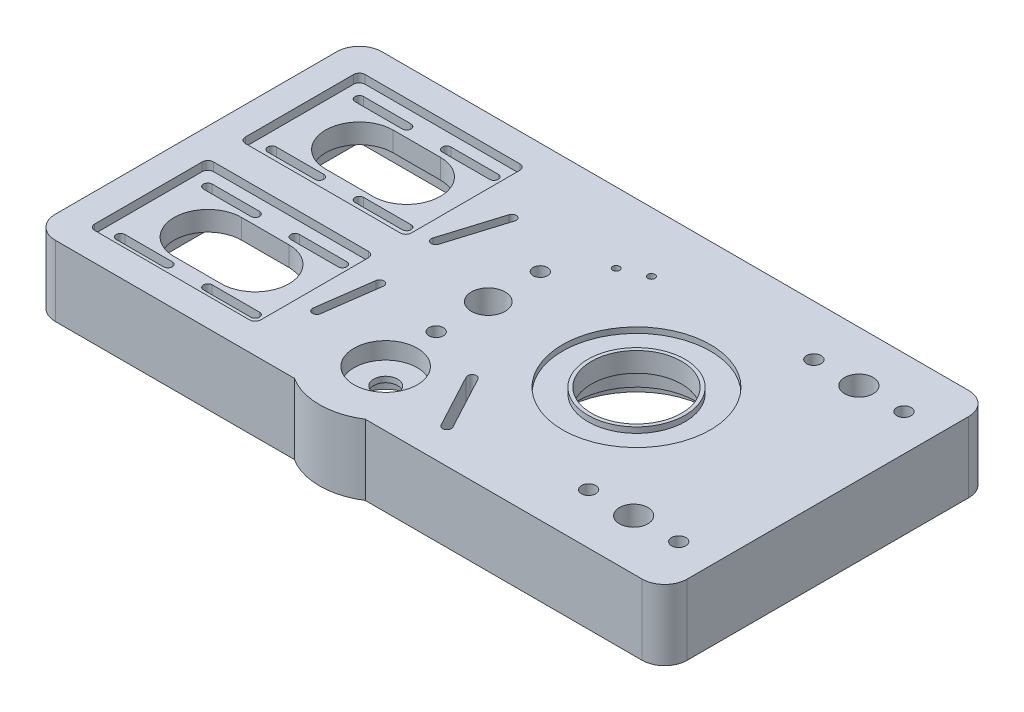
from build123d import *

# Parameters (mm, degrees)
BOSS_EXTRUDE1_DEPTH      = 10
SKETCH6_R                = 30
BOSS_EXTRUDE3_DEPTH      = 10
SKETCH40_R               = 26.25
CUT_EXTRUDE1_DEPTH       = 5
SKETCH42_R               = 21.25
CUT_EXTRUDE2_DEPTH       = 8
SKETCH43_R               = 16
CUT_EXTRUDE3_DEPTH       = 132.224624055
CUT_EXTRUDE4_START       = -2
SKETCH44_R               = 26.25
SKETCH44_R_2             = 17.25
CUT_EXTRUDE4_DEPTH       = 2
CUT_EXTRUDE5_DEPTH       = 3
CUT_EXTRUDE6_DEPTH       = 132.681061503
SKETCH48_R               = 3.5
CUT_EXTRUDE7_DEPTH       = 132.681061503
SKETCH49_R               = 11.25
CUT_EXTRUDE8_DEPTH       = 6
SKETCH50_R               = 4.25
CUT_EXTRUDE9_DEPTH       = 132.327460793
CUT_EXTRUDE10_START      = -2
SKETCH51_R               = 11.25
CUT_EXTRUDE10_DEPTH      = 2
SKETCH56_R               = 5.05
SKETCH56_R_2             = 2.55
CUT_EXTRUDE13_DEPTH      = 133.101862055
SKETCH54_R               = 6
SKETCH54_R_2             = 2.55
CUT_EXTRUDE12_DEPTH      = 10
SKETCH55_R               = 5.05
SKETCH55_R_2             = 2.55
CUT_EXTRUDE14_DEPTH      = 133.101862055
CUT_EXTRUDE17_DEPTH      = 3
EXTRUDE_THIN4_DEPTH      = 15
EXTRUDE_THIN4_DEPTH_BACK = 10
FILLET2_R                = 20
RIB4_REACH               = 139.012
SKETCH70_WALL_W          = 309.542427542
SKETCH70_WALL_H          = 5
RIB5_REACH               = 170.812
SKETCH71_WALL_W          = 363.94870324
SKETCH71_WALL_H          = 5
RIB6_REACH               = 170.812
SKETCH72_WALL_W          = 364.28015487
SKETCH72_WALL_H          = 5
CUT_EXTRUDE18_REACH      = 140.464
SKETCH73_R               = 1.25
CUT_EXTRUDE19_REACH      = 139.012
CUT_EXTRUDE20_REACH      = 139.012
CUT_EXTRUDE21_REACH      = 139.012
BOSS_EXTRUDE4_DEPTH      = 10
CUT_EXTRUDE22_REACH      = 139.012
SKETCH84_R               = 5.05
SKETCH84_R_2             = 2.55
CUT_EXTRUDE23_REACH      = 235.23
SKETCH86_R               = 2.05
SKETCH87_R               = 14
SKETCH87_R_2             = 11.25
BOSS_EXTRUDE5_DEPTH      = 5
BOSS_EXTRUDE6_DEPTH      = 5
CUT_EXTRUDE24_REACH      = 139.649
SKETCH89_R               = 5.05
SKETCH89_R_2             = 2.55


with BuildPart() as part:
    # Sketch1 → Boss-Extrude1 (new body)
    with BuildSketch(Plane(origin=(0, 0, 0), x_dir=(1, 0, 0), z_dir=(0, 1, 0))):
        with BuildLine():
            Line((-113.431000834, 55), (95, 55))
            ThreePointArc((95, 55), (98.535533906, 53.535533906), (100, 50))
            Line((100, 50), (100, -50))
            ThreePointArc((100, -50), (98.535533906, -53.535533906), (95, -55))
            Line((95, -55), (-113.431000834, -55))
            ThreePointArc((-113.431000834, -55), (-116.966534739, -53.535533906), (-118.431000834, -50))
            Line((-118.431000834, -50), (-118.431000834, 50))
            ThreePointArc((-118.431000834, 50), (-116.966534739, 53.535533906), (-113.431000834, 55))
        make_face()
    extrude(amount=BOSS_EXTRUDE1_DEPTH)

    # Sketch6 → Boss-Extrude3 (add)
    with BuildSketch(Plane.XZ):
        with Locations((35, 0)):
            Circle(SKETCH6_R)
    extrude(amount=BOSS_EXTRUDE3_DEPTH)

    # Sketch40 → Cut-Extrude1 (cut)
    with BuildSketch(Plane.XZ.offset(10)):
        with Locations((35, 0)):
            Circle(SKETCH40_R)
    extrude(amount=-CUT_EXTRUDE1_DEPTH, mode=Mode.SUBTRACT)

    # Sketch42 → Cut-Extrude2 (cut)
    with BuildSketch(Plane.XZ.offset(5)):
        with Locations((35, 0)):
            Circle(SKETCH42_R)
    extrude(amount=-CUT_EXTRUDE2_DEPTH, mode=Mode.SUBTRACT)

    # Sketch43 → Cut-Extrude3 (cut, through all)
    with BuildSketch(Plane.XZ.offset(-3)):
        with Locations((35, 0)):
            Circle(SKETCH43_R)
    extrude(amount=-CUT_EXTRUDE3_DEPTH, mode=Mode.SUBTRACT)

    # Sketch44 → Cut-Extrude4 (cut)
    with BuildSketch(Plane(origin=(0, 10, 0), x_dir=(1, 0, 0), z_dir=(0, 1, 0)).offset(CUT_EXTRUDE4_START)):
        with Locations((35, 0)):
            Circle(SKETCH44_R)
        with Locations((35, 0)):
            Circle(SKETCH44_R_2, mode=Mode.SUBTRACT)
    extrude(amount=CUT_EXTRUDE4_DEPTH, mode=Mode.SUBTRACT)

    # Sketch45 → Cut-Extrude5 (cut)
    with BuildSketch(Plane(origin=(0, 10, 0), x_dir=(1, 0, 0), z_dir=(0, 1, 0))):
        with BuildLine():
            Line((-109.431000834, 48), (-54.431000834, 48))
            ThreePointArc((-54.431000834, 48), (-53.016787271, 47.414213562), (-52.431000834, 46))
            Line((-52.431000834, 46), (-52.431000834, 7.5))
            ThreePointArc((-52.431000834, 7.5), (-53.016787271, 6.085786438), (-54.431000834, 5.5))
            Line((-54.431000834, 5.5), (-109.431000834, 5.5))
            ThreePointArc((-109.431000834, 5.5), (-110.845214396, 6.085786438), (-111.431000834, 7.5))
            Line((-111.431000834, 7.5), (-111.431000834, 46))
            ThreePointArc((-111.431000834, 46), (-110.845214396, 47.414213562), (-109.431000834, 48))
        make_face()
        with BuildLine():
            Line((-109.431000834, -5.8), (-54.431000834, -5.8))
            ThreePointArc((-54.431000834, -5.8), (-53.016787271, -6.385786438), (-52.431000834, -7.8))
            Line((-52.431000834, -7.8), (-52.431000834, -46))
            ThreePointArc((-52.431000834, -46), (-53.016787271, -47.414213562), (-54.431000834, -48))
            Line((-54.431000834, -48), (-109.431000834, -48))
            ThreePointArc((-109.431000834, -48), (-110.845214396, -47.414213562), (-111.431000834, -46))
            Line((-111.431000834, -46), (-111.431000834, -7.8))
            ThreePointArc((-111.431000834, -7.8), (-110.845214396, -6.385786438), (-109.431000834, -5.8))
        make_face()
    extrude(amount=-CUT_EXTRUDE5_DEPTH, mode=Mode.SUBTRACT)

    # Sketch47 → Cut-Extrude6 (cut, through all)
    with BuildSketch(Plane(origin=(0, 7, 0), x_dir=(1, 0, 0), z_dir=(0, 1, 0))):
        with BuildLine():
            Line((-90.331000834, -14.9), (-73.531000834, -14.9))
            ThreePointArc((-73.531000834, -14.9), (-61.531000834, -26.9), (-73.531000834, -38.9))
            Line((-73.531000834, -38.9), (-90.331000834, -38.9))
            ThreePointArc((-90.331000834, -38.9), (-102.331000834, -26.9), (-90.331000834, -14.9))
        make_face()
        with BuildLine():
            Line((-105.831000834, -9.85), (-89.031000834, -9.85))
            ThreePointArc((-89.031000834, -9.85), (-87.481000834, -11.4), (-89.031000834, -12.95))
            Line((-89.031000834, -12.95), (-105.831000834, -12.95))
            ThreePointArc((-105.831000834, -12.95), (-107.381000834, -11.4), (-105.831000834, -9.85))
        make_face()
        with BuildLine():
            Line((-58.031000834, -12.95), (-74.831000834, -12.95))
            ThreePointArc((-74.831000834, -12.95), (-76.381000834, -11.4), (-74.831000834, -9.85))
            Line((-74.831000834, -9.85), (-58.031000834, -9.85))
            ThreePointArc((-58.031000834, -9.85), (-56.481000834, -11.4), (-58.031000834, -12.95))
        make_face()
        with BuildLine():
            Line((-105.831000834, -40.85), (-89.031000834, -40.85))
            ThreePointArc((-89.031000834, -40.85), (-87.481000834, -42.4), (-89.031000834, -43.95))
            Line((-89.031000834, -43.95), (-105.831000834, -43.95))
            ThreePointArc((-105.831000834, -43.95), (-107.381000834, -42.4), (-105.831000834, -40.85))
        make_face()
        with BuildLine():
            Line((-58.031000834, -43.95), (-74.831000834, -43.95))
            ThreePointArc((-74.831000834, -43.95), (-76.381000834, -42.4), (-74.831000834, -40.85))
            Line((-74.831000834, -40.85), (-58.031000834, -40.85))
            ThreePointArc((-58.031000834, -40.85), (-56.481000834, -42.4), (-58.031000834, -43.95))
        make_face()
    cut_extrude6 = extrude(amount=-CUT_EXTRUDE6_DEPTH, mode=Mode.SUBTRACT)

    # Sketch48 → Cut-Extrude7 (cut, through all)
    with BuildSketch(Plane(origin=(0, 7, 0), x_dir=(1, 0, 0), z_dir=(0, 1, 0))):
        with Locations((-81.931000834, 26.75)):
            Circle(SKETCH48_R)
    extrude(amount=-CUT_EXTRUDE7_DEPTH, mode=Mode.SUBTRACT)

    # Sketch49 → Cut-Extrude8 (cut)
    with BuildSketch(Plane(origin=(0, 10, 0), x_dir=(1, 0, 0), z_dir=(0, 1, 0))):
        with Locations((-15.928527985, -38.159399026)):
            Circle(SKETCH49_R)
    extrude(amount=-CUT_EXTRUDE8_DEPTH, mode=Mode.SUBTRACT)

    # Sketch50 → Cut-Extrude9 (cut, through all)
    with BuildSketch(Plane(origin=(0, 4, 0), x_dir=(1, 0, 0), z_dir=(0, 1, 0))):
        with Locations((-15.928527985, -38.159399026)):
            Circle(SKETCH50_R)
    extrude(amount=-CUT_EXTRUDE9_DEPTH, mode=Mode.SUBTRACT)

    # Sketch51 → Cut-Extrude10 (cut)
    with BuildSketch(Plane.XZ.offset(CUT_EXTRUDE10_START)):
        with Locations((-15.928527985, 38.159399026)):
            Circle(SKETCH51_R)
    extrude(amount=CUT_EXTRUDE10_DEPTH, mode=Mode.SUBTRACT)

    # Sketch56 → Cut-Extrude13 (cut, through all)
    with BuildSketch(Plane(origin=(0, 10, 0), x_dir=(1, 0, 0), z_dir=(0, 1, 0))):
        with Locations((74, 40)):
            Circle(SKETCH56_R)
        with Locations((58, 40)):
            Circle(SKETCH56_R_2)
        with Locations((90, 40)):
            Circle(SKETCH56_R_2)
    extrude(amount=-CUT_EXTRUDE13_DEPTH, mode=Mode.SUBTRACT)

    # Sketch54 → Cut-Extrude12 (cut)
    with BuildSketch(Plane(origin=(0, 10, 0), x_dir=(1, 0, 0), z_dir=(0, 1, 0))):
        with Locations((-17.651513899, 0)):
            Circle(SKETCH54_R)
        with Locations((-17.651513899, 18.5)):
            Circle(SKETCH54_R_2)
        with Locations((-17.651513899, -18.5)):
            Circle(SKETCH54_R_2)
    extrude(amount=-CUT_EXTRUDE12_DEPTH, mode=Mode.SUBTRACT)

    # Sketch55 → Cut-Extrude14 (cut, through all)
    with BuildSketch(Plane(origin=(0, 10, 0), x_dir=(1, 0, 0), z_dir=(0, 1, 0))):
        with Locations((74, -40)):
            Circle(SKETCH55_R)
        with Locations((58, -40)):
            Circle(SKETCH55_R_2)
        with Locations((90, -40)):
            Circle(SKETCH55_R_2)
    extrude(amount=-CUT_EXTRUDE14_DEPTH, mode=Mode.SUBTRACT)

    # Sketch61 → Cut-Extrude17 (cut)
    with BuildSketch(Plane.XZ):
        Polygon((-22.321107831, 18.754740085), (-20.20692225, 14.583383072), (-15.537328318, 14.328642987), (-12.981919967, 18.245259915), (-15.096105548, 22.416616928), (-19.76569948, 22.671357013), align=None)
        Polygon((-19.877874662, -22.612580425), (-15.203095157, -22.484375191), (-12.976734394, -18.371794766), (-15.425153137, -14.387419575), (-20.099932641, -14.515624809), (-22.326293404, -18.628205234), align=None)
    extrude(amount=-CUT_EXTRUDE17_DEPTH, mode=Mode.SUBTRACT)

    # Sketch66 → Extrude-Thin4 (add, two sides: drawn at the far end of the back side and taken through both)
    with BuildSketch(Plane.XZ.offset(-EXTRUDE_THIN4_DEPTH_BACK)):
        with BuildLine():
            Line((-113.431000834, -58), (95, -58))
            ThreePointArc((95, -58), (100.656854249, -55.656854249), (103, -50))
            Line((103, -50), (103, 50))
            ThreePointArc((103, 50), (100.656854249, 55.656854249), (95, 58))
            Line((95, 58), (-3.334856837, 58))
            ThreePointArc((-3.334856837, 58), (-15.928527985, 61.659399026), (-28.522199134, 58))
            Line((-28.522199134, 58), (-113.431000834, 58))
            ThreePointArc((-113.431000834, 58), (-119.087855083, 55.65685425), (-121.431000834, 50))
            Line((-121.431000834, 50), (-121.431000834, -50))
            ThreePointArc((-121.431000834, -50), (-119.087855083, -55.656854249), (-113.431000834, -58))
        make_face()
        with BuildLine():
            Line((-113.431000834, -51), (95, -51))
            ThreePointArc((95, -51), (95.707106781, -50.707106781), (96, -50))
            Line((96, -50), (96, 50))
            ThreePointArc((96, 50), (95.707106781, 50.707106781), (95, 51))
            Line((95, 51), (-5.566628225, 51))
            ThreePointArc((-5.566628225, 51), (-15.928527985, 54.659399026), (-26.290427745, 51))
            Line((-26.290427745, 51), (-113.431000834, 51))
            ThreePointArc((-113.431000834, 51), (-114.138107615, 50.707106781), (-114.431000834, 50))
            Line((-114.431000834, 50), (-114.431000834, -50))
            ThreePointArc((-114.431000834, -50), (-114.138107615, -50.707106781), (-113.431000834, -51))
        make_face(mode=Mode.SUBTRACT)
    extrude(amount=EXTRUDE_THIN4_DEPTH + EXTRUDE_THIN4_DEPTH_BACK)

    # Fillet2
    fillet2_edges = [part.edges().sort_by_distance(p)[0] for p in [
        (-5.566628225, -7.5, 51),
        (-26.290427745, -7.5, 51),
    ]]
    fillet(fillet2_edges, radius=FILLET2_R)

    # Sketch70 wall → Rib4 (add, up to next)
    with BuildSketch(Plane(origin=(79.598324748, -8.380465105, 0), x_dir=(1, 0, 0), z_dir=(0, 1, 0)), mode=Mode.PRIVATE) as rib4_sk1:
        Rectangle(SKETCH70_WALL_W, SKETCH70_WALL_H)
    rib4_tool1 = extrude(rib4_sk1.sketch, amount=RIB4_REACH, mode=Mode.PRIVATE) - part.part
    add(rib4_tool1.solids().sort_by_distance((79.598324748, -8.380465105, 0))[0])

    # Sketch71 wall → Rib5 (add, up to next)
    with BuildSketch(Plane(origin=(35, -9.8209949, -39.762366941), x_dir=(0, 0, -1), z_dir=(0, 1, 0)), mode=Mode.PRIVATE) as rib5_sk1:
        Rectangle(SKETCH71_WALL_W, SKETCH71_WALL_H)
    rib5_tool1 = extrude(rib5_sk1.sketch, amount=RIB5_REACH, mode=Mode.PRIVATE) - part.part
    add(rib5_tool1.solids().sort_by_distance((35, -9.8209949, -39.762366941))[0])

    # Sketch72 wall → Rib6 (add, up to next)
    with BuildSketch(Plane(origin=(35, -9.863987499, 40.423821676), x_dir=(0, 0, 1), z_dir=(0, -1, 0)), mode=Mode.PRIVATE) as rib6_sk1:
        Rectangle(SKETCH72_WALL_W, SKETCH72_WALL_H)
    rib6_tool1 = extrude(rib6_sk1.sketch, amount=-RIB6_REACH, mode=Mode.PRIVATE) - part.part
    add(rib6_tool1.solids().sort_by_distance((35, -9.863987499, 40.423821676))[0])

    # Sketch73 → Cut-Extrude18 (cut, up to next)
    with BuildSketch(Plane(origin=(0, 10, 0), x_dir=(1, 0, 0), z_dir=(0, 1, 0)), mode=Mode.PRIVATE) as cut_extrude18_sk1:
        with Locations((3.560683326, 36.739699283)):
            Circle(SKETCH73_R)
    cut_extrude18_tool1 = extrude(cut_extrude18_sk1.sketch, amount=-CUT_EXTRUDE18_REACH, mode=Mode.PRIVATE) & part.part
    # Sketch73 → Cut-Extrude18 (cut, up to next)
    with BuildSketch(Plane(origin=(0, 10, 0), x_dir=(1, 0, 0), z_dir=(0, 1, 0)), mode=Mode.PRIVATE) as cut_extrude18_sk2:
        with Locations((-5.155533979, 32.961133962)):
            Circle(SKETCH73_R)
    cut_extrude18_tool2 = extrude(cut_extrude18_sk2.sketch, amount=-CUT_EXTRUDE18_REACH, mode=Mode.PRIVATE) & part.part
    add(cut_extrude18_tool1.solids().sort_by_distance((3.560683, 10, -36.739699))[0], mode=Mode.SUBTRACT)
    add(cut_extrude18_tool2.solids().sort_by_distance((-5.155534, 10, -32.961134))[0], mode=Mode.SUBTRACT)

    # Sketch77 → Cut-Extrude19 (cut, up to next)
    with BuildSketch(Plane.XZ, mode=Mode.PRIVATE) as cut_extrude19_sk1:
        with BuildLine():
            Line((14.672766795, 44.90068706), (4.354482331, 25.654457198))
            ThreePointArc((4.354482331, 25.654457198), (2.256045461, 25.020767445), (1.622355708, 27.119204315))
            Line((1.622355708, 27.119204315), (11.940640172, 46.365434176))
            ThreePointArc((11.940640172, 46.365434176), (14.039077042, 46.99912393), (14.672766795, 44.90068706))
        make_face()
    cut_extrude19_tool1 = extrude(cut_extrude19_sk1.sketch, amount=-CUT_EXTRUDE19_REACH, mode=Mode.PRIVATE) & part.part
    add(cut_extrude19_tool1.solids().sort_by_distance((8.147561, 0, 36.009946))[0], mode=Mode.SUBTRACT)

    # Sketch80 → Cut-Extrude20 (cut, up to next)
    with BuildSketch(Plane.XZ, mode=Mode.PRIVATE) as cut_extrude20_sk1:
        with BuildLine():
            Line((-44.10054998, 13.492705301), (-46.7890867, 33.064247752))
            ThreePointArc((-46.7890867, 33.064247752), (-45.464449545, 34.810768982), (-43.717928314, 33.486131827))
            Line((-43.717928314, 33.486131827), (-41.029391595, 13.914589376))
            ThreePointArc((-41.029391595, 13.914589376), (-42.35402875, 12.168068146), (-44.10054998, 13.492705301))
        make_face()
    cut_extrude20_tool1 = extrude(cut_extrude20_sk1.sketch, amount=-CUT_EXTRUDE20_REACH, mode=Mode.PRIVATE) & part.part
    add(cut_extrude20_tool1.solids().sort_by_distance((-43.909239, 0, 23.489419))[0], mode=Mode.SUBTRACT)

    # Mirror2: Cut-Extrude6 across plane
    add(cut_extrude6.mirror(Plane.XY), mode=Mode.SUBTRACT)

    # Sketch81 → Cut-Extrude21 (cut, up to next)
    with BuildSketch(Plane.XZ, mode=Mode.PRIVATE) as cut_extrude21_sk1:
        with BuildLine():
            Line((-40.723344344, -30.409410194), (-47.077608488, -9.745602981))
            ThreePointArc((-47.077608488, -9.745602981), (-46.051656037, -7.808486162), (-44.114539219, -8.834438614))
            Line((-44.114539219, -8.834438614), (-37.760275075, -29.498245827))
            ThreePointArc((-37.760275075, -29.498245827), (-38.786227526, -31.435362646), (-40.723344344, -30.409410194))
        make_face()
    cut_extrude21_tool1 = extrude(cut_extrude21_sk1.sketch, amount=-CUT_EXTRUDE21_REACH, mode=Mode.PRIVATE) & part.part
    add(cut_extrude21_tool1.solids().sort_by_distance((-42.418942, 0, -19.621924))[0], mode=Mode.SUBTRACT)

    # Sketch82 → Boss-Extrude4 (add)
    with BuildSketch(Plane.XZ):
        with BuildLine():
            Line((48, 51), (96, 51))
            Line((96, 51), (96, 24))
            Line((96, 24), (53, 24))
            ThreePointArc((53, 24), (50.574204955, 25.640673549), (48, 27.037011669))
            Line((48, 27.037011669), (48, 51))
        make_face()
        with BuildLine():
            Line((96, -24), (53, -24))
            ThreePointArc((53, -24), (50.574204955, -25.640673549), (48, -27.037011669))
            Line((48, -27.037011669), (48, -51))
            Line((48, -51), (96, -51))
            Line((96, -51), (96, -24))
        make_face()
    extrude(amount=BOSS_EXTRUDE4_DEPTH)

    # Sketch84 → Cut-Extrude22 (cut, up to next)
    with BuildSketch(Plane(origin=(0, 0, 0), x_dir=(1, 0, 0), z_dir=(0, 1, 0)), mode=Mode.PRIVATE) as cut_extrude22_sk1:
        with Locations((74, 40)):
            Circle(SKETCH84_R)
    cut_extrude22_tool1 = extrude(cut_extrude22_sk1.sketch, amount=-CUT_EXTRUDE22_REACH, mode=Mode.PRIVATE) & part.part
    # Sketch84 → Cut-Extrude22 (cut, up to next)
    with BuildSketch(Plane(origin=(0, 0, 0), x_dir=(1, 0, 0), z_dir=(0, 1, 0)), mode=Mode.PRIVATE) as cut_extrude22_sk2:
        with Locations((90, 40)):
            Circle(SKETCH84_R_2)
    cut_extrude22_tool2 = extrude(cut_extrude22_sk2.sketch, amount=-CUT_EXTRUDE22_REACH, mode=Mode.PRIVATE) & part.part
    # Sketch84 → Cut-Extrude22 (cut, up to next)
    with BuildSketch(Plane(origin=(0, 0, 0), x_dir=(1, 0, 0), z_dir=(0, 1, 0)), mode=Mode.PRIVATE) as cut_extrude22_sk3:
        with Locations((58, 40)):
            Circle(SKETCH84_R_2)
    cut_extrude22_tool3 = extrude(cut_extrude22_sk3.sketch, amount=-CUT_EXTRUDE22_REACH, mode=Mode.PRIVATE) & part.part
    # Sketch84 → Cut-Extrude22 (cut, up to next)
    with BuildSketch(Plane(origin=(0, 0, 0), x_dir=(1, 0, 0), z_dir=(0, 1, 0)), mode=Mode.PRIVATE) as cut_extrude22_sk4:
        with Locations((74, -40)):
            Circle(SKETCH84_R)
    cut_extrude22_tool4 = extrude(cut_extrude22_sk4.sketch, amount=-CUT_EXTRUDE22_REACH, mode=Mode.PRIVATE) & part.part
    # Sketch84 → Cut-Extrude22 (cut, up to next)
    with BuildSketch(Plane(origin=(0, 0, 0), x_dir=(1, 0, 0), z_dir=(0, 1, 0)), mode=Mode.PRIVATE) as cut_extrude22_sk5:
        with Locations((90, -40)):
            Circle(SKETCH84_R_2)
    cut_extrude22_tool5 = extrude(cut_extrude22_sk5.sketch, amount=-CUT_EXTRUDE22_REACH, mode=Mode.PRIVATE) & part.part
    # Sketch84 → Cut-Extrude22 (cut, up to next)
    with BuildSketch(Plane(origin=(0, 0, 0), x_dir=(1, 0, 0), z_dir=(0, 1, 0)), mode=Mode.PRIVATE) as cut_extrude22_sk6:
        with Locations((58, -40)):
            Circle(SKETCH84_R_2)
    cut_extrude22_tool6 = extrude(cut_extrude22_sk6.sketch, amount=-CUT_EXTRUDE22_REACH, mode=Mode.PRIVATE) & part.part
    add(cut_extrude22_tool1.solids().sort_by_distance((74, 0, -40))[0], mode=Mode.SUBTRACT)
    add(cut_extrude22_tool2.solids().sort_by_distance((90, 0, -40))[0], mode=Mode.SUBTRACT)
    add(cut_extrude22_tool3.solids().sort_by_distance((58, 0, -40))[0], mode=Mode.SUBTRACT)
    add(cut_extrude22_tool4.solids().sort_by_distance((74, 0, 40))[0], mode=Mode.SUBTRACT)
    add(cut_extrude22_tool5.solids().sort_by_distance((90, 0, 40))[0], mode=Mode.SUBTRACT)
    add(cut_extrude22_tool6.solids().sort_by_distance((58, 0, 40))[0], mode=Mode.SUBTRACT)

    # Sketch86 → Cut-Extrude23 (cut, up to next)
    with BuildSketch(Plane.ZY.offset(121.431000834), mode=Mode.PRIVATE) as cut_extrude23_sk1:
        with Locations((-20, -6)):
            Circle(SKETCH86_R)
    cut_extrude23_tool1 = extrude(cut_extrude23_sk1.sketch, amount=-CUT_EXTRUDE23_REACH, mode=Mode.PRIVATE) & part.part
    # Sketch86 → Cut-Extrude23 (cut, up to next)
    with BuildSketch(Plane.ZY.offset(121.431000834), mode=Mode.PRIVATE) as cut_extrude23_sk2:
        with Locations((20, -6)):
            Circle(SKETCH86_R)
    cut_extrude23_tool2 = extrude(cut_extrude23_sk2.sketch, amount=-CUT_EXTRUDE23_REACH, mode=Mode.PRIVATE) & part.part
    add(cut_extrude23_tool1.solids().sort_by_distance((-121.431001, -6, -20))[0], mode=Mode.SUBTRACT)
    add(cut_extrude23_tool2.solids().sort_by_distance((-121.431001, -6, 20))[0], mode=Mode.SUBTRACT)

    # Sketch87 → Boss-Extrude5 (add)
    with BuildSketch(Plane.XZ):
        with Locations((-15.928527985, 38.159399026)):
            Circle(SKETCH87_R)
        with Locations((-15.928527985, 38.159399026)):
            Circle(SKETCH87_R_2, mode=Mode.SUBTRACT)
    extrude(amount=BOSS_EXTRUDE5_DEPTH)

    # Sketch88 → Boss-Extrude6 (add)
    with BuildSketch(Plane.XZ.offset(10)):
        Polygon((48, 36.215910209), (63.895316795, 24), (96, 24), (96, 51), (48, 51), align=None)
        Polygon((48, -36.238896089), (64.862991868, -24), (96, -24), (96, -51), (48, -51), align=None)
    extrude(amount=BOSS_EXTRUDE6_DEPTH)

    # Sketch89 → Cut-Extrude24 (cut, up to next)
    with BuildSketch(Plane(origin=(0, -10, 0), x_dir=(1, 0, 0), z_dir=(0, 1, 0)), mode=Mode.PRIVATE) as cut_extrude24_sk1:
        with Locations((74, -40)):
            Circle(SKETCH89_R)
    cut_extrude24_tool1 = extrude(cut_extrude24_sk1.sketch, amount=-CUT_EXTRUDE24_REACH, mode=Mode.PRIVATE) & part.part
    # Sketch89 → Cut-Extrude24 (cut, up to next)
    with BuildSketch(Plane(origin=(0, -10, 0), x_dir=(1, 0, 0), z_dir=(0, 1, 0)), mode=Mode.PRIVATE) as cut_extrude24_sk2:
        with Locations((58, -40)):
            Circle(SKETCH89_R_2)
    cut_extrude24_tool2 = extrude(cut_extrude24_sk2.sketch, amount=-CUT_EXTRUDE24_REACH, mode=Mode.PRIVATE) & part.part
    # Sketch89 → Cut-Extrude24 (cut, up to next)
    with BuildSketch(Plane(origin=(0, -10, 0), x_dir=(1, 0, 0), z_dir=(0, 1, 0)), mode=Mode.PRIVATE) as cut_extrude24_sk3:
        with Locations((90, -40)):
            Circle(SKETCH89_R_2)
    cut_extrude24_tool3 = extrude(cut_extrude24_sk3.sketch, amount=-CUT_EXTRUDE24_REACH, mode=Mode.PRIVATE) & part.part
    # Sketch89 → Cut-Extrude24 (cut, up to next)
    with BuildSketch(Plane(origin=(0, -10, 0), x_dir=(1, 0, 0), z_dir=(0, 1, 0)), mode=Mode.PRIVATE) as cut_extrude24_sk4:
        with Locations((74, 40)):
            Circle(SKETCH89_R)
    cut_extrude24_tool4 = extrude(cut_extrude24_sk4.sketch, amount=-CUT_EXTRUDE24_REACH, mode=Mode.PRIVATE) & part.part
    # Sketch89 → Cut-Extrude24 (cut, up to next)
    with BuildSketch(Plane(origin=(0, -10, 0), x_dir=(1, 0, 0), z_dir=(0, 1, 0)), mode=Mode.PRIVATE) as cut_extrude24_sk5:
        with Locations((90, 40)):
            Circle(SKETCH89_R_2)
    cut_extrude24_tool5 = extrude(cut_extrude24_sk5.sketch, amount=-CUT_EXTRUDE24_REACH, mode=Mode.PRIVATE) & part.part
    # Sketch89 → Cut-Extrude24 (cut, up to next)
    with BuildSketch(Plane(origin=(0, -10, 0), x_dir=(1, 0, 0), z_dir=(0, 1, 0)), mode=Mode.PRIVATE) as cut_extrude24_sk6:
        with Locations((58, 40)):
            Circle(SKETCH89_R_2)
    cut_extrude24_tool6 = extrude(cut_extrude24_sk6.sketch, amount=-CUT_EXTRUDE24_REACH, mode=Mode.PRIVATE) & part.part
    add(cut_extrude24_tool1.solids().sort_by_distance((74, -10, 40))[0], mode=Mode.SUBTRACT)
    add(cut_extrude24_tool2.solids().sort_by_distance((58, -10, 40))[0], mode=Mode.SUBTRACT)
    add(cut_extrude24_tool3.solids().sort_by_distance((90, -10, 40))[0], mode=Mode.SUBTRACT)
    add(cut_extrude24_tool4.solids().sort_by_distance((74, -10, -40))[0], mode=Mode.SUBTRACT)
    add(cut_extrude24_tool5.solids().sort_by_distance((90, -10, -40))[0], mode=Mode.SUBTRACT)
    add(cut_extrude24_tool6.solids().sort_by_distance((58, -10, -40))[0], mode=Mode.SUBTRACT)


solid = part.part
